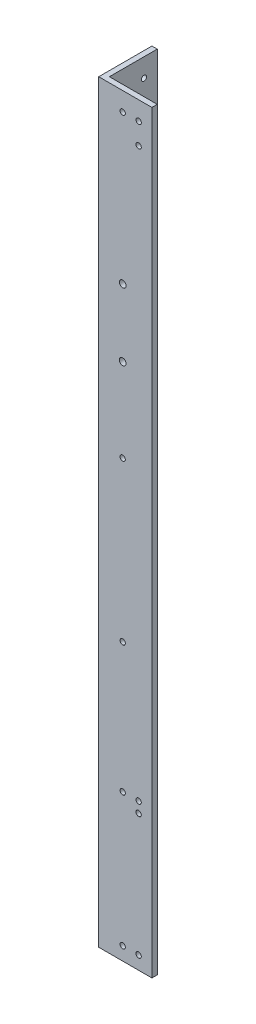
from build123d import *

# Parameters (mm, degrees)
BOSS_EXTRUDE1_DEPTH               = 450
FRONTSIDEHOLES_SKETCH3_R          = 1.5875
FRONTSIDEHOLES_SKETCH3_R_2        = 2
FRONTSIDEHOLES_CUT_EXTRUDE1_DEPTH = 3.175
LEFTSIDEHOLES_SKETCH4_R           = 1.5875
LEFTSIDEHOLES_CUT_EXTRUDE2_DEPTH  = 3.175


with BuildPart() as part:
    # Sketch2 → Boss-Extrude1 (new body)
    with BuildSketch(Plane(origin=(0, 0, 0), x_dir=(1, 0, 0), z_dir=(0, 1, 0))):
        Polygon((0, 31.75), (3.175, 31.75), (3.175, 3.175), (31.75, 3.175), (31.75, 0), (0, 0), align=None)
    extrude(amount=BOSS_EXTRUDE1_DEPTH)

    # FrontSideHoles-Sketch3 → FrontSideHoles-Cut-Extrude1 (cut)
    with BuildSketch(Plane.XY):
        with Locations((23.8125, 81.1125)):
            Circle(FRONTSIDEHOLES_SKETCH3_R)
        with Locations((14.2875, 87.4625)):
            Circle(FRONTSIDEHOLES_SKETCH3_R)
        with Locations((23.8125, 87.4625)):
            Circle(FRONTSIDEHOLES_SKETCH3_R)
        with Locations((14.2875, 438.8875)):
            Circle(FRONTSIDEHOLES_SKETCH3_R)
        with Locations((23.8125, 438.8875)):
            Circle(FRONTSIDEHOLES_SKETCH3_R)
        with Locations((23.8125, 426.1875)):
            Circle(FRONTSIDEHOLES_SKETCH3_R)
        with Locations((14.2875, 350.015144)):
            Circle(FRONTSIDEHOLES_SKETCH3_R_2)
        with Locations((14.2875, 309.815144)):
            Circle(FRONTSIDEHOLES_SKETCH3_R_2)
        with Locations((14.2875, 260)):
            Circle(FRONTSIDEHOLES_SKETCH3_R)
        with Locations((14.2875, 165)):
            Circle(FRONTSIDEHOLES_SKETCH3_R)
        with Locations((14.2875, 7.9375)):
            Circle(FRONTSIDEHOLES_SKETCH3_R)
        with Locations((23.8125, 7.9375)):
            Circle(FRONTSIDEHOLES_SKETCH3_R)
    extrude(amount=-FRONTSIDEHOLES_CUT_EXTRUDE1_DEPTH, mode=Mode.SUBTRACT)

    # LeftSideHoles-Sketch4 → LeftSideHoles-Cut-Extrude2 (cut)
    with BuildSketch(Plane.ZY):
        with Locations((-23.8125, 81.1125)):
            Circle(LEFTSIDEHOLES_SKETCH4_R)
        with Locations((-14.2875, 81.1125)):
            Circle(LEFTSIDEHOLES_SKETCH4_R)
        with Locations((-23.8125, 87.4625)):
            Circle(LEFTSIDEHOLES_SKETCH4_R)
        with Locations((-23.8125, 438.8875)):
            Circle(LEFTSIDEHOLES_SKETCH4_R)
        with Locations((-23.8125, 426.1875)):
            Circle(LEFTSIDEHOLES_SKETCH4_R)
        with Locations((-14.2875, 426.1875)):
            Circle(LEFTSIDEHOLES_SKETCH4_R)
        with Locations((-23.8125, 332.377644)):
            Circle(LEFTSIDEHOLES_SKETCH4_R)
        with Locations((-14.2875, 332.377644)):
            Circle(LEFTSIDEHOLES_SKETCH4_R)
        with Locations((-23.8125, 297.452644)):
            Circle(LEFTSIDEHOLES_SKETCH4_R)
        with Locations((-14.2875, 297.452644)):
            Circle(LEFTSIDEHOLES_SKETCH4_R)
        with Locations((-23.8125, 7.9375)):
            Circle(LEFTSIDEHOLES_SKETCH4_R)
        with Locations((-14.2875, 7.9375)):
            Circle(LEFTSIDEHOLES_SKETCH4_R)
        with Locations((-14.2875, 165)):
            Circle(LEFTSIDEHOLES_SKETCH4_R)
        with Locations((-14.2875, 260)):
            Circle(LEFTSIDEHOLES_SKETCH4_R)
        with Locations((-14.2875, 355)):
            Circle(LEFTSIDEHOLES_SKETCH4_R)
    extrude(amount=-LEFTSIDEHOLES_CUT_EXTRUDE2_DEPTH, mode=Mode.SUBTRACT)


solid = part.part
